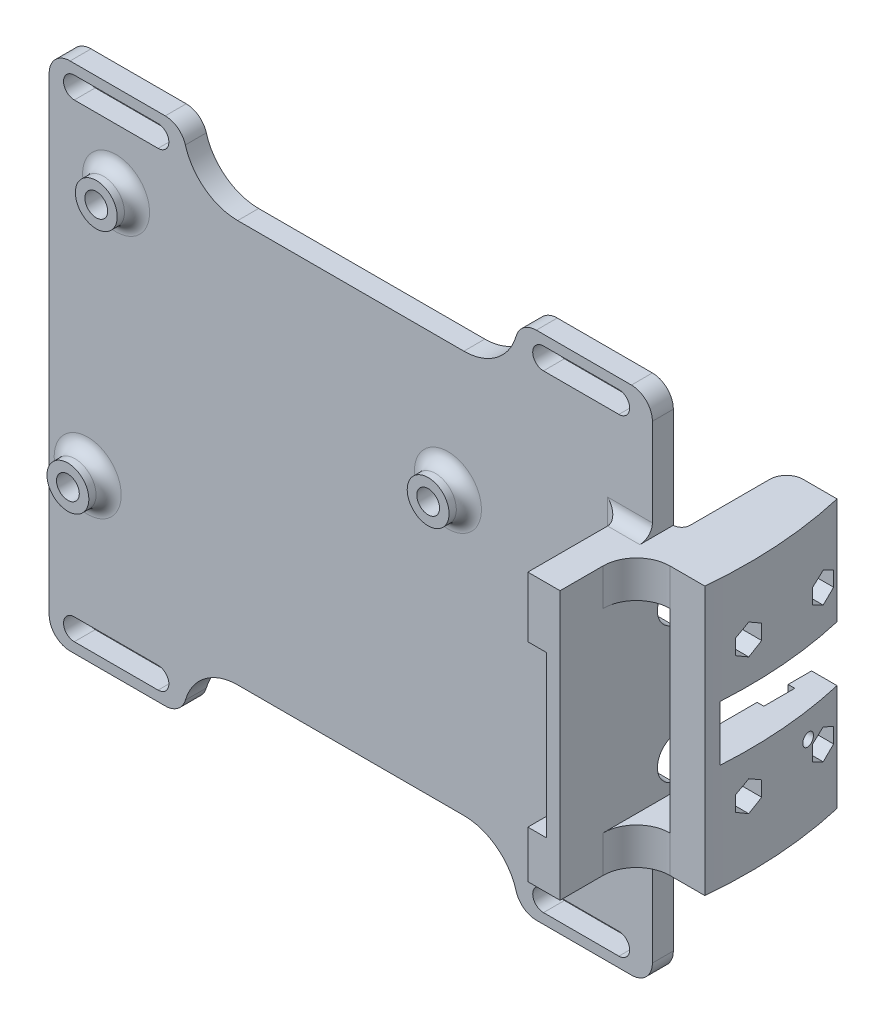
from build123d import *

# Parameters (mm, degrees)
SKETCH1_W                      = 105.41
SKETCH1_H                      = 60.96
BOSS_EXTRUDE1_DEPTH            = 3.175
SKETCH20_W                     = 20.32
SKETCH20_H                     = 3.175
MOUNTING_TAB_DEPTH             = 8.255
FILLET10_R                     = 8.255
SKETCH3_W                      = 4.88696
SKETCH3_H                      = 40.64
BOSS_EXTRUDE2_DEPTH            = 13.9954
FILLET2_R                      = 1.905
SKETCH4_W                      = 5.6388
SKETCH4_H                      = 24.3332
SD_CARD_SLOT_DEPTH             = 2.794
MOUNTING_SLOTS_REACH           = 69.624
SKETCH8_W                      = 27.813
SKETCH8_H                      = 40.64
CAMERA_MOUNT_DEPTH             = 38.1
CUT_EXTRUDE7_DEPTH             = 116.460326027
CUT_EXTRUDE7_DEPTH_BACK        = 116.460326027
SKETCH10_W                     = 254
SKETCH10_H                     = 254
SKETCH10_R                     = 66.675
CUT_EXTRUDE8_DEPTH             = 77.677505528
CUT_EXTRUDE8_DEPTH_BACK        = 73.613505528
CUT_EXTRUDE8_START             = -4.064
SKETCH9_W                      = 5.08
SKETCH9_H                      = 29.464
SKETCH11_R                     = 0.3175
SKETCH11_W                     = 21.844
SKETCH11_H                     = 8.382
CAMERA_HOLES_DEPTH             = 119.335383386
SKETCH36_W                     = 4.699
SKETCH36_H                     = 5.08
CUT_EXTRUDE19_DEPTH            = 1.016
SKETCH6_R                      = 3.175
PI_PCB_STANDOFF_DEPTH          = 3
F_1_CLEARANCE_HOLE1_AT_2_COUNT = 2
F_1_CLEARANCE_HOLE1_AT_2_PITCH = 12.446
F_1_CLEARANCE_HOLE1_AT_3_COUNT = 2
F_1_CLEARANCE_HOLE1_AT_3_PITCH = 24.045631454
F_1_CLEARANCE_HOLE1_AT_4_COUNT = 2
F_1_CLEARANCE_HOLE1_AT_4_PITCH = 20.574
CUT_EXTRUDE21_REACH            = 121.605
CUT_EXTRUDE21_END_RADIUS       = 66.675
CUT_EXTRUDE21_START            = -1.27
SKETCH18_R                     = 1.4605
CUT_EXTRUDE13_DEPTH            = 78.477350587
HEX_HOLES_DEPTH                = 2.54
F_4_CLEARANCE_HOLE1_D          = 3.4544
F_4_CLEARANCE_HOLE1_DEPTH      = 17.170425
SKETCH34_W                     = 1.27
SKETCH34_H                     = 28.523215287
CUT_EXTRUDE16_DEPTH            = 89.308848878
CUT_EXTRUDE17_REACH            = 125.415
CUT_EXTRUDE17_END_RADIUS       = 66.675
CUT_EXTRUDE17_START            = 5.08
SKETCH35_W                     = 6.35
SKETCH35_H                     = 40.64
FILLET9_R                      = 5.08
FILLET1_R                      = 1.905
FILLET5_R                      = 1.27
FILLET6_R                      = 2.54
CUT_EXTRUDE23_START            = 5.08
SKETCH41_R                     = 3.175
CUT_EXTRUDE23_DEPTH            = 12.7
SKETCH43_W                     = 25.4
SKETCH43_H                     = 101.6
CUT_EXTRUDE24_DEPTH            = 77.677505528
FILLET14_R                     = 3.175
SKETCH44_R                     = 0.9525
CUT_EXTRUDE25_DEPTH            = 107.341403905


with BuildPart() as part:
    # Sketch1 → Boss-Extrude1 (new body)
    with BuildSketch(Plane.XY):
        Rectangle(SKETCH1_W, SKETCH1_H)
    extrude(amount=BOSS_EXTRUDE1_DEPTH)

    # Sketch20 → Mounting Tab (add)
    with BuildSketch(Plane(origin=(0, 30.48, 0), x_dir=(1, 0, 0), z_dir=(0, 1, 0))):
        with Locations((-28.575, -1.5875)):
            Rectangle(SKETCH20_W, SKETCH20_H)
        with Locations((42.545, -1.5875)):
            Rectangle(SKETCH20_W, SKETCH20_H)
    mounting_tab = extrude(amount=MOUNTING_TAB_DEPTH)

    # Mirror1: Mounting Tab across plane
    add(mounting_tab.mirror(Plane.ZX))

    # Fillet10
    fillet10_edges = [part.edges().sort_by_distance(p)[0] for p in [
        (-38.735, 30.48, 1.5875),
        (-18.415, 30.48, 1.5875),
        (-38.735, -30.48, 1.5875),
        (-18.415, -30.48, 1.5875),
        (32.385, -30.48, 1.5875),
        (32.385, 30.48, 1.5875),
    ]]
    fillet(fillet10_edges, radius=FILLET10_R - 0.0001)  # a hair under: the kernel refuses the full size

    # Sketch3 → Boss-Extrude2 (add)
    with BuildSketch(Plane.XY.offset(3.175)):
        with Locations((50.26152, 0)):
            Rectangle(SKETCH3_W, SKETCH3_H)
    extrude(amount=BOSS_EXTRUDE2_DEPTH)

    # Fillet2
    fillet2_edges = [part.edges().sort_by_distance(p)[0] for p in [
        (50.26152, -20.32, 3.175),
        (47.81804, 0, 3.175),
        (50.26152, 20.32, 3.175),
    ]]
    fillet(fillet2_edges, radius=FILLET2_R)

    # Sketch4 → SD card Slot (cut)
    with BuildSketch(Plane.ZY.offset(-47.81804)):
        with Locations((14.351, -0.9906)):
            Rectangle(SKETCH4_W, SKETCH4_H)
    extrude(amount=-SD_CARD_SLOT_DEPTH, mode=Mode.SUBTRACT)

    # Sketch5 → Mounting slots (cut, up to next)
    with BuildSketch(Plane(origin=(0, 0, 0), x_dir=(-1, 0, 0), z_dir=(0, 0, -1)), mode=Mode.PRIVATE) as mounting_slots_sk1:
        with BuildLine():
            Line((22.225, 37.19195), (34.925, 37.19195))
            ThreePointArc((34.925, 37.19195), (36.55695, 35.56), (34.925, 33.92805))
            Line((34.925, 33.92805), (22.225, 33.92805))
            ThreePointArc((22.225, 33.92805), (20.59305, 35.56), (22.225, 37.19195))
        make_face()
    mounting_slots_tool1 = extrude(mounting_slots_sk1.sketch, amount=-MOUNTING_SLOTS_REACH, mode=Mode.PRIVATE) & part.part
    # Sketch5 → Mounting slots (cut, up to next)
    with BuildSketch(Plane(origin=(0, 0, 0), x_dir=(-1, 0, 0), z_dir=(0, 0, -1)), mode=Mode.PRIVATE) as mounting_slots_sk2:
        with BuildLine():
            Line((-47.625, -33.92805), (-36.195, -33.92805))
            ThreePointArc((-36.195, -33.92805), (-34.56305, -35.56), (-36.195, -37.19195))
            Line((-36.195, -37.19195), (-47.625, -37.19195))
            ThreePointArc((-47.625, -37.19195), (-49.25695, -35.56), (-47.625, -33.92805))
        make_face()
    mounting_slots_tool2 = extrude(mounting_slots_sk2.sketch, amount=-MOUNTING_SLOTS_REACH, mode=Mode.PRIVATE) & part.part
    # Sketch5 → Mounting slots (cut, up to next)
    with BuildSketch(Plane(origin=(0, 0, 0), x_dir=(-1, 0, 0), z_dir=(0, 0, -1)), mode=Mode.PRIVATE) as mounting_slots_sk3:
        with BuildLine():
            Line((-47.625, 37.19195), (-36.195, 37.19195))
            ThreePointArc((-36.195, 37.19195), (-34.56305, 35.56), (-36.195, 33.92805))
            Line((-36.195, 33.92805), (-47.625, 33.92805))
            ThreePointArc((-47.625, 33.92805), (-49.25695, 35.56), (-47.625, 37.19195))
        make_face()
    mounting_slots_tool3 = extrude(mounting_slots_sk3.sketch, amount=-MOUNTING_SLOTS_REACH, mode=Mode.PRIVATE) & part.part
    # Sketch5 → Mounting slots (cut, up to next)
    with BuildSketch(Plane(origin=(0, 0, 0), x_dir=(-1, 0, 0), z_dir=(0, 0, -1)), mode=Mode.PRIVATE) as mounting_slots_sk4:
        with BuildLine():
            Line((22.225, -37.19195), (34.925, -37.19195))
            ThreePointArc((34.925, -37.19195), (36.55695, -35.56), (34.925, -33.92805))
            Line((34.925, -33.92805), (22.225, -33.92805))
            ThreePointArc((22.225, -33.92805), (20.59305, -35.56), (22.225, -37.19195))
        make_face()
    mounting_slots_tool4 = extrude(mounting_slots_sk4.sketch, amount=-MOUNTING_SLOTS_REACH, mode=Mode.PRIVATE) & part.part
    add(mounting_slots_tool1.solids().sort_by_distance((-28.575, 35.56, 0))[0], mode=Mode.SUBTRACT)
    add(mounting_slots_tool2.solids().sort_by_distance((41.91, -35.56, 0))[0], mode=Mode.SUBTRACT)
    add(mounting_slots_tool3.solids().sort_by_distance((41.91, 35.56, 0))[0], mode=Mode.SUBTRACT)
    add(mounting_slots_tool4.solids().sort_by_distance((-28.575, -35.56, 0))[0], mode=Mode.SUBTRACT)

    # Sketch8 → Camera Mount (add)
    with BuildSketch(Plane(origin=(52.705, 0, 0), x_dir=(0, 0, -1), z_dir=(1, 0, 0))):
        with Locations((1.9685, 0)):
            Rectangle(SKETCH8_W, SKETCH8_H)
    extrude(amount=CAMERA_MOUNT_DEPTH)

    # Sketch10 → Cut-Extrude7 (cut, two sides: drawn at the far end of the back side and taken through both)
    with BuildSketch(Plane(origin=(0, 30.48, 0), x_dir=(1, 0, 0), z_dir=(0, 1, 0)).offset(-CUT_EXTRUDE7_DEPTH_BACK)):
        with Locations((2.821418608, -6.153022645)):
            Rectangle(SKETCH10_W, SKETCH10_H)
        with Locations((-3.302, 0.8001)):
            Circle(SKETCH10_R, mode=Mode.SUBTRACT)
    extrude(amount=CUT_EXTRUDE7_DEPTH + CUT_EXTRUDE7_DEPTH_BACK, mode=Mode.SUBTRACT)

    # Sketch9 → Cut-Extrude8 (cut, two sides: drawn at the far end of the back side and taken through both)
    with BuildSketch(Plane.XY.offset(3.175).offset(CUT_EXTRUDE8_START - CUT_EXTRUDE8_DEPTH_BACK)):
        with Locations((55.245, 0)):
            Rectangle(SKETCH9_W, SKETCH9_H)
    extrude(amount=CUT_EXTRUDE8_DEPTH + CUT_EXTRUDE8_DEPTH_BACK, mode=Mode.SUBTRACT)

    # Sketch11 → Camera holes (cut, through all)
    with BuildSketch(Plane.ZY.offset(-57.785)):
        with Locations((-0.762, -10.287)):
            Circle(SKETCH11_R)
        with Locations((-0.762, 10.287)):
            Circle(SKETCH11_R)
        with Locations((-13.208, 10.287)):
            Circle(SKETCH11_R)
        with Locations((-13.208, -10.287)):
            Circle(SKETCH11_R)
        with Locations((-7.493, 0)):
            Rectangle(SKETCH11_W, SKETCH11_H)
    extrude(amount=-CAMERA_HOLES_DEPTH, mode=Mode.SUBTRACT)

    # Sketch36 → Cut-Extrude19 (cut)
    with BuildSketch(Plane.ZY.offset(-57.785)):
        with Locations((-9.9695, -6.731)):
            Rectangle(SKETCH36_W, SKETCH36_H)
    extrude(amount=-CUT_EXTRUDE19_DEPTH, mode=Mode.SUBTRACT)

    # Sketch6 → Pi PCB standoff (add)
    with BuildSketch(Plane.XY.offset(3.175)):
        with Locations(Location((-32.89696, -14.38737, 0), (0, 0, 180))):
            Circle(SKETCH6_R)
        with Locations(Location((21.71304, 11.01263, 0), (0, 0, 180))):
            Circle(SKETCH6_R)
        with Locations(Location((-28.59166, 24.85563, 0), (0, 0, 180))):
            Circle(SKETCH6_R)
    extrude(amount=PI_PCB_STANDOFF_DEPTH)

    # Sketch38 → #1 Clearance Hole1 (revolve, cut)
    with BuildSketch(Plane(origin=(57.785, 10.287, -13.208), x_dir=(0, 0, 1), z_dir=(0, 1, 0))):
        Polygon((0, 0), (0, 10.618085319), (1.0287, 9.99998), (1.0287, 0), align=None)
    f_1_clearance_hole1 = revolve(axis=Axis((51.435, 10.287, -13.208), (1, 0, 0)), mode=Mode.SUBTRACT)

    # #1 Clearance Hole1 at 2: #1 Clearance Hole1 ×2
    with Locations(*[(0, 0, i * F_1_CLEARANCE_HOLE1_AT_2_PITCH) for i in range(1, F_1_CLEARANCE_HOLE1_AT_2_COUNT)]):
        add(f_1_clearance_hole1, mode=Mode.SUBTRACT)

    # #1 Clearance Hole1 at 3: #1 Clearance Hole1 ×2
    with Locations(*[Vector(0, -0.8556231945808053, 0.5175992164748103) * (i * F_1_CLEARANCE_HOLE1_AT_3_PITCH) for i in range(1, F_1_CLEARANCE_HOLE1_AT_3_COUNT)]):
        add(f_1_clearance_hole1, mode=Mode.SUBTRACT)

    # #1 Clearance Hole1 at 4: #1 Clearance Hole1 ×2
    with Locations(*[(0, -i * F_1_CLEARANCE_HOLE1_AT_4_PITCH, 0) for i in range(1, F_1_CLEARANCE_HOLE1_AT_4_COUNT)]):
        add(f_1_clearance_hole1, mode=Mode.SUBTRACT)

    # Cut-Extrude21: up to this cylinder (the profile starts inside it)
    cut_extrude21_end = Plane(origin=(-3.302, 0, -0.8001), z_dir=(0, 1, 0)) * Cylinder(CUT_EXTRUDE21_END_RADIUS, 398.134, mode=Mode.PRIVATE)
    # Sketch40 → Cut-Extrude21 (cut, up to the surface)
    with BuildSketch(Plane.ZY.offset(-57.785).offset(CUT_EXTRUDE21_START), mode=Mode.PRIVATE) as cut_extrude21_sk1:
        Polygon((-13.208, 7.995641119), (-11.223625, 9.14132056), (-11.223625, 11.43267944), (-13.208, 12.578358881), (-15.192375, 11.43267944), (-15.192375, 9.14132056), align=None)
    cut_extrude21_tool1 = extrude(cut_extrude21_sk1.sketch, amount=-CUT_EXTRUDE21_REACH, mode=Mode.PRIVATE) & cut_extrude21_end
    add(cut_extrude21_tool1.solids().sort_by_distance((59.055, 10.287, -13.208))[0], mode=Mode.SUBTRACT)
    # Sketch40 → Cut-Extrude21 (cut, up to the surface)
    with BuildSketch(Plane.ZY.offset(-57.785).offset(CUT_EXTRUDE21_START), mode=Mode.PRIVATE) as cut_extrude21_sk2:
        Polygon((-0.762, 7.995641119), (1.222375, 9.14132056), (1.222375, 11.43267944), (-0.762, 12.578358881), (-2.746375, 11.43267944), (-2.746375, 9.14132056), align=None)
    cut_extrude21_tool2 = extrude(cut_extrude21_sk2.sketch, amount=-CUT_EXTRUDE21_REACH, mode=Mode.PRIVATE) & cut_extrude21_end
    add(cut_extrude21_tool2.solids().sort_by_distance((59.055, 10.287, -0.762))[0], mode=Mode.SUBTRACT)
    # Sketch40 → Cut-Extrude21 (cut, up to the surface)
    with BuildSketch(Plane.ZY.offset(-57.785).offset(CUT_EXTRUDE21_START), mode=Mode.PRIVATE) as cut_extrude21_sk3:
        Polygon((-0.762, -12.578358881), (1.222375, -11.43267944), (1.222375, -9.14132056), (-0.762, -7.995641119), (-2.746375, -9.14132056), (-2.746375, -11.43267944), align=None)
    cut_extrude21_tool3 = extrude(cut_extrude21_sk3.sketch, amount=-CUT_EXTRUDE21_REACH, mode=Mode.PRIVATE) & cut_extrude21_end
    add(cut_extrude21_tool3.solids().sort_by_distance((59.055, -10.287, -0.762))[0], mode=Mode.SUBTRACT)
    # Sketch40 → Cut-Extrude21 (cut, up to the surface)
    with BuildSketch(Plane.ZY.offset(-57.785).offset(CUT_EXTRUDE21_START), mode=Mode.PRIVATE) as cut_extrude21_sk4:
        Polygon((-13.208, -12.578358881), (-11.223625, -11.43267944), (-11.223625, -9.14132056), (-13.208, -7.995641119), (-15.192375, -9.14132056), (-15.192375, -11.43267944), align=None)
    cut_extrude21_tool4 = extrude(cut_extrude21_sk4.sketch, amount=-CUT_EXTRUDE21_REACH, mode=Mode.PRIVATE) & cut_extrude21_end
    add(cut_extrude21_tool4.solids().sort_by_distance((59.055, -10.287, -13.208))[0], mode=Mode.SUBTRACT)

    # Sketch18 → Cut-Extrude13 (cut, through all)
    with BuildSketch(Plane.XY.offset(6.175)):
        with Locations((21.71304, 11.01263)):
            Circle(SKETCH18_R)
        with Locations((-32.89696, -14.38737)):
            Circle(SKETCH18_R)
    extrude(amount=-CUT_EXTRUDE13_DEPTH, mode=Mode.SUBTRACT)

    # Sketch29 → hex holes (cut)
    with BuildSketch(Plane(origin=(0, 0, 0), x_dir=(-1, 0, 0), z_dir=(0, 0, -1))):
        Polygon((-18.985406388, 11.01263), (-20.349223194, 13.37483), (-23.076856806, 13.37483), (-24.440673612, 11.01263), (-23.076856806, 8.65043), (-20.349223194, 8.65043), align=None)
        Polygon((35.624593612, -14.38737), (34.260776806, -12.02517), (31.533143194, -12.02517), (30.169326388, -14.38737), (31.533143194, -16.74957), (34.260776806, -16.74957), align=None)
        Polygon((27.227843194, 22.49343), (29.955476806, 22.49343), (31.319293612, 24.85563), (29.955476806, 27.21783), (27.227843194, 27.21783), (25.864026388, 24.85563), align=None)
    extrude(amount=-HEX_HOLES_DEPTH, mode=Mode.SUBTRACT)

    # #4 Clearance Hole1
    with Locations(Plane(origin=(0, 0, 0), x_dir=(-1, 0, 0), z_dir=(0, 0, -1))):
        with Locations((32.89696, -14.38737), (-21.71304, 11.01263), (28.59166, 24.85563)):
            Hole(F_4_CLEARANCE_HOLE1_D / 2, depth=F_4_CLEARANCE_HOLE1_DEPTH)

    # Sketch34 → Cut-Extrude16 (cut, through all)
    with BuildSketch(Plane(origin=(0, 20.32, 0), x_dir=(1, 0, 0), z_dir=(0, 1, 0))):
        with Locations((53.34, 14.261607644)):
            Rectangle(SKETCH34_W, SKETCH34_H)
    extrude(amount=-CUT_EXTRUDE16_DEPTH, mode=Mode.SUBTRACT)

    # Cut-Extrude17: up to this cylinder (the profile starts inside it)
    cut_extrude17_end = Plane(origin=(-3.302, 0, -0.8001), z_dir=(0, 1, 0)) * Cylinder(CUT_EXTRUDE17_END_RADIUS, 385.18, mode=Mode.PRIVATE)
    # Sketch35 → Cut-Extrude17 (cut, up to the surface)
    with BuildSketch(Plane.ZY.offset(-57.785).offset(CUT_EXTRUDE17_START), mode=Mode.PRIVATE) as cut_extrude17_sk1:
        with Locations((8.763, 0)):
            Rectangle(SKETCH35_W, SKETCH35_H)
    cut_extrude17_tool1 = extrude(cut_extrude17_sk1.sketch, amount=-CUT_EXTRUDE17_REACH, mode=Mode.PRIVATE) & cut_extrude17_end
    add(cut_extrude17_tool1.solids().sort_by_distance((52.705, 0, 8.763))[0], mode=Mode.SUBTRACT)

    # Fillet9
    fillet9_edges = [part.edges().sort_by_distance(p)[0] for p in [
        (52.705, 17.526, 5.588),
        (52.705, -17.526, 5.588),
    ]]
    fillet(fillet9_edges, radius=FILLET9_R)

    # Fillet1
    fillet1_edges = [part.edges().sort_by_distance(p)[0] for p in [
        (-29.72196, -14.38737, 3.175),
        (24.88804, 11.01263, 3.175),
        (-25.41666, 24.85563, 3.175),
    ]]
    fillet(fillet1_edges, radius=FILLET1_R)

    # Fillet5
    fillet5_edges = [part.edges().sort_by_distance(p)[0] for p in [
        (53.975, -17.526, 0),
        (53.975, 17.526, 0),
    ]]
    fillet(fillet5_edges, radius=FILLET5_R)

    # Fillet6
    fillet6_edges = [part.edges().sort_by_distance(p)[0] for p in [
        (53.975, 17.526, -15.875),
        (53.975, -17.526, -15.875),
    ]]
    fillet(fillet6_edges, radius=FILLET6_R)

    # Sketch41 → Cut-Extrude23 (cut)
    with BuildSketch(Plane.ZY.offset(-57.785).offset(CUT_EXTRUDE23_START)):
        with Locations((-0.762, 10.287)):
            Circle(SKETCH41_R)
        with Locations((-0.762, -10.287)):
            Circle(SKETCH41_R)
    extrude(amount=CUT_EXTRUDE23_DEPTH, mode=Mode.SUBTRACT)

    # Sketch43 → Cut-Extrude24 (cut, through all)
    with BuildSketch(Plane.XY.offset(3.175)):
        with Locations((-51.435, 0)):
            Rectangle(SKETCH43_W, SKETCH43_H)
    extrude(amount=-CUT_EXTRUDE24_DEPTH, mode=Mode.SUBTRACT)

    # Fillet14
    fillet14_edges = [part.edges().sort_by_distance(p)[0] for p in [
        (-18.415, 38.735, 1.5875),
        (-38.735, 38.735, 1.5875),
        (-38.735, -38.735, 1.5875),
        (-18.415, -38.735, 1.5875),
        (32.385, 38.735, 1.5875),
        (52.705, 38.735, 1.5875),
        (52.705, -38.735, 1.5875),
        (32.385, -38.735, 1.5875),
    ]]
    fillet(fillet14_edges, radius=FILLET14_R)

    # Sketch44 → Cut-Extrude25 (cut, through all)
    with BuildSketch(Plane.ZY.offset(-58.801)):
        with Locations((-10.4775, -8.0518)):
            Circle(SKETCH44_R)
    extrude(amount=-CUT_EXTRUDE25_DEPTH, mode=Mode.SUBTRACT)


solid = part.part
